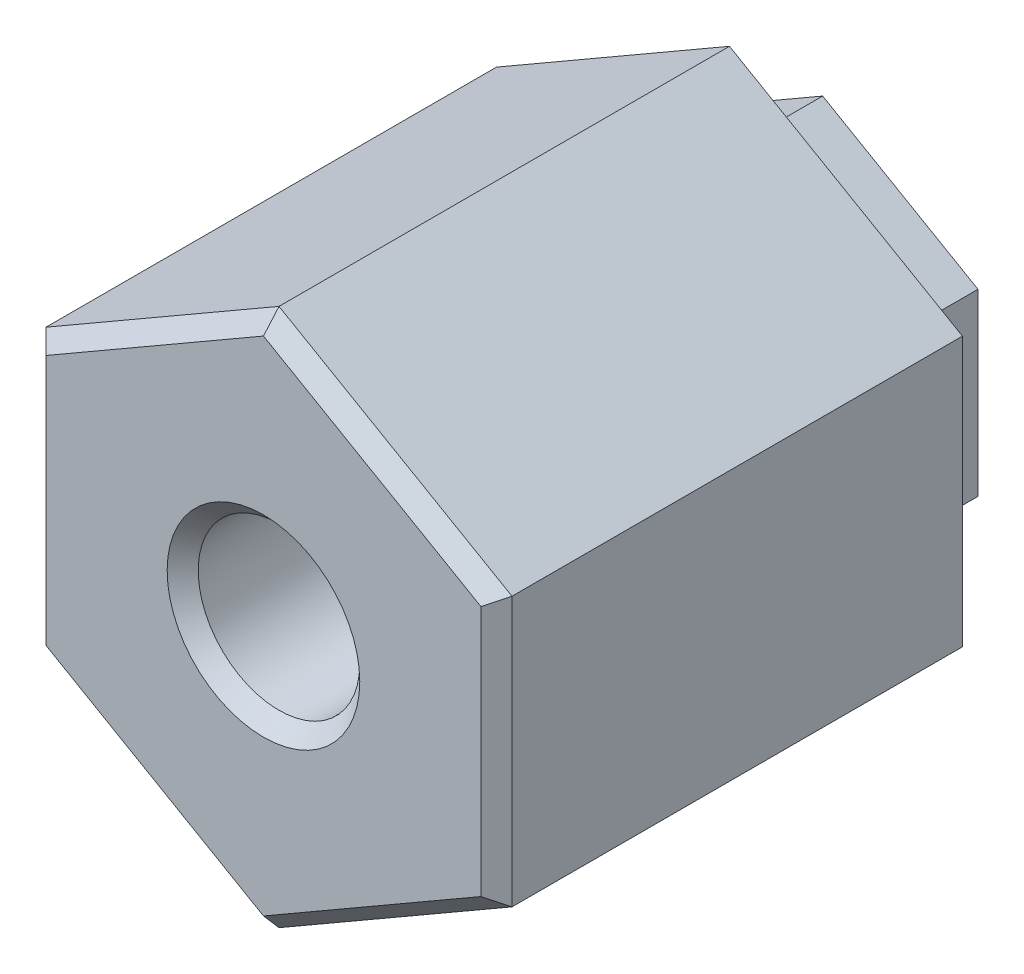
from build123d import *

# Parameters (mm, degrees)
BOSS_EXTRUDE1_DEPTH = 15
BOSS_EXTRUDE2_DEPTH = 3
SKETCH2_R           = 2.6
CUT_EXTRUDE1_DEPTH  = 22.336588293
CHAMFER1_SIZE       = 0.5


with BuildPart() as part:
    # Sketch1 → Boss-Extrude1 (new body)
    with BuildSketch(Plane.XY):
        Polygon((0, 8.660254038), (-7.5, 4.330127019), (-7.5, -4.330127019), (0, -8.660254038), (7.5, -4.330127019), (7.5, 4.330127019), align=None)
    extrude(amount=BOSS_EXTRUDE1_DEPTH)

    # Sketch3 → Boss-Extrude2 (add)
    with BuildSketch(Plane(origin=(0, 0, 0), x_dir=(-1, 0, 0), z_dir=(0, 0, -1))):
        Polygon((0, 5.773502692), (-5, 2.886751346), (-5, -2.886751346), (0, -5.773502692), (5, -2.886751346), (5, 2.886751346), align=None)
    extrude(amount=BOSS_EXTRUDE2_DEPTH)

    # Sketch2 → Cut-Extrude1 (cut, through all)
    with BuildSketch(Plane.XY.offset(15)):
        Circle(SKETCH2_R)
    extrude(amount=-CUT_EXTRUDE1_DEPTH, mode=Mode.SUBTRACT)

    # Chamfer1
    chamfer1_edges = [part.edges().sort_by_distance(p)[0] for p in [
        (7.5, 0, 15),
        (3.75, -6.495190528, 15),
        (-3.75, -6.495190528, 15),
        (-7.5, 0, 15),
        (-3.75, 6.495190528, 15),
        (3.75, 6.495190528, 15),
        (-2.6, 0, 15),
    ]]
    chamfer(chamfer1_edges, length=CHAMFER1_SIZE)


solid = part.part
